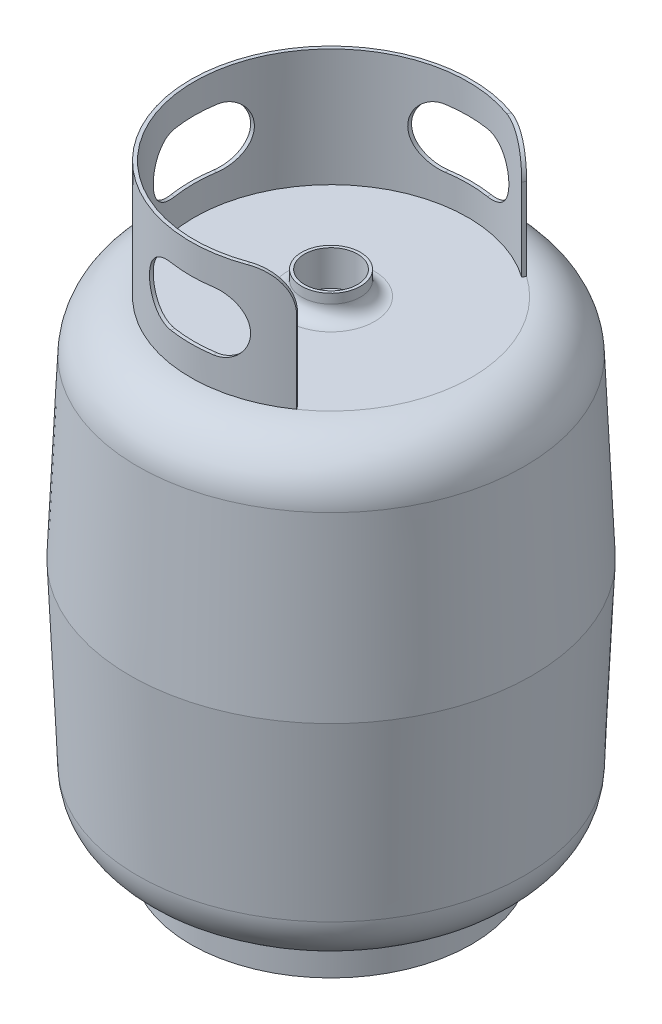
from build123d import *

# Parameters (mm, degrees)
BOSS_EXTRUDE1_DEPTH     = 100
CUT_EXTRUDE1_DEPTH      = 545.160288675
CIRPATTERN1_COUNT       = 2
CIRPATTERN1_ANGLE       = 90
FILLET1_R               = 30
FILLET2_R               = 30
BOSS_EXTRUDE2_START     = 30
SKETCH6_R               = 119.421871599
BOSS_EXTRUDE2_DEPTH     = 30
CUT_EXTRUDE2_DEPTH      = 572.192104177
CUT_EXTRUDE2_DEPTH_BACK = 30
SKETCH7_R               = 116.421871599
SKETCH8_R               = 22.5
CUT_EXTRUDE4_DEPTH      = 30


with BuildPart() as part:
    # Sketch1 → Revolve2 (revolve)
    with BuildSketch(Plane.XY):
        with BuildLine():
            Line((0, 0), (119.421871599, 0))
            ThreePointArc((119.421871599, 0), (150.539959109, 12.493621707), (164.37904157, 43.037127569))
            Line((164.37904157, 43.037127569), (170.959307689, 193.75))
            Line((170.959307689, 193.75), (164.37904157, 344.462872431))
            ThreePointArc((164.37904157, 344.462872431), (150.539959109, 375.006378293), (119.421871599, 387.5))
            Line((119.421871599, 387.5), (37, 387.5))
            ThreePointArc((37, 387.5), (28.514718626, 391.014718626), (25, 399.5))
            Line((25, 399.5), (25, 407.5))
            Line((25, 407.5), (0, 407.5))
            Line((0, 407.5), (0, 0))
        make_face()
    revolve(axis=Axis((0, 0, 0), (0, 1, 0)))

    # Sketch2 → Boss-Extrude1 (add)
    with BuildSketch(Plane(origin=(0, 387.5, 0), x_dir=(1, 0, 0), z_dir=(0, 1, 0))):
        with BuildLine():
            ThreePointArc((66.776842225, -95.36721412), (-116.421871599, 0), (66.776842225, 95.36721412))
            Line((66.776842225, 95.36721412), (68.497571534, 97.824670253))
            ThreePointArc((68.497571534, 97.824670253), (-119.421871599, 0), (68.497571534, -97.824670253))
            Line((68.497571534, -97.824670253), (66.776842225, -95.36721412))
        make_face()
    extrude(amount=BOSS_EXTRUDE1_DEPTH)

    # Sketch4 → Cut-Extrude1 (cut, symmetric)
    with BuildSketch(Plane.XY):
        with BuildLine():
            Line((18, 412.5), (-18, 412.5))
            ThreePointArc((-18, 412.5), (-43, 437.5), (-18, 462.5))
            Line((-18, 462.5), (18, 462.5))
            ThreePointArc((18, 462.5), (43, 437.5), (18, 412.5))
        make_face()
    cut_extrude1 = extrude(amount=CUT_EXTRUDE1_DEPTH, both=True, mode=Mode.SUBTRACT)

    # CirPattern1: Cut-Extrude1 ×2 about axis
    cirpattern1_axis = Axis((0, 387.5, 0), (0, -1, 0))
    for i in range(1, CIRPATTERN1_COUNT):
        add(cut_extrude1.rotate(cirpattern1_axis, i * CIRPATTERN1_ANGLE / (CIRPATTERN1_COUNT - 1)), mode=Mode.SUBTRACT)

    # Fillet1
    # the kernel refuses this fillet: 30 mm, written as the material it takes off along each edge
    with BuildSketch(Plane(origin=(111.51580426, 487.5, 159.261073574), x_dir=(0, -1, 0), z_dir=(-0.5735764363510427, 0, -0.8191520442889941))) as fillet1_piece_1:
        with BuildLine():
            CenterArc((FILLET1_R, FILLET1_R), FILLET1_R, 180, 90)
            Line((0, FILLET1_R), (0, 0))
            Line((0, 0), (FILLET1_R, 0))
        make_face()
    extrude(amount=153, mode=Mode.SUBTRACT)

    # Fillet2
    # the kernel refuses this fillet: 30 mm, written as the material it takes off along each edge
    with BuildSketch(Plane(origin=(23.758609498, 487.5, -33.930810798), x_dir=(0, -1, 0), z_dir=(0.5735764363510427, 0, -0.8191520442889941))) as fillet2_piece_1:
        with BuildLine():
            CenterArc((FILLET2_R, FILLET2_R), FILLET2_R, 180, 90)
            Line((0, FILLET2_R), (0, 0))
            Line((0, 0), (FILLET2_R, 0))
        make_face()
    extrude(amount=153, mode=Mode.SUBTRACT)

    # Sketch6 → Boss-Extrude2 (add)
    with BuildSketch(Plane.XZ.offset(BOSS_EXTRUDE2_START)):
        Circle(SKETCH6_R)
    extrude(amount=-BOSS_EXTRUDE2_DEPTH)

    # Sketch7 → Cut-Extrude2 (cut, two sides: drawn at the far end of the back side and taken through both)
    with BuildSketch(Plane.XZ.offset(30).offset(-CUT_EXTRUDE2_DEPTH_BACK)):
        with Locations(Location((0, 0, 0), (0, 0, 180))):
            Circle(SKETCH7_R)
    extrude(amount=CUT_EXTRUDE2_DEPTH + CUT_EXTRUDE2_DEPTH_BACK, mode=Mode.SUBTRACT)

    # Sketch8 → Cut-Extrude4 (cut)
    with BuildSketch(Plane(origin=(0, 407.5, 0), x_dir=(1, 0, 0), z_dir=(0, 1, 0))):
        with Locations(Location((0, 0, 0), (0, 0, 180))):
            Circle(SKETCH8_R)
    extrude(amount=-CUT_EXTRUDE4_DEPTH, mode=Mode.SUBTRACT)


solid = part.part
